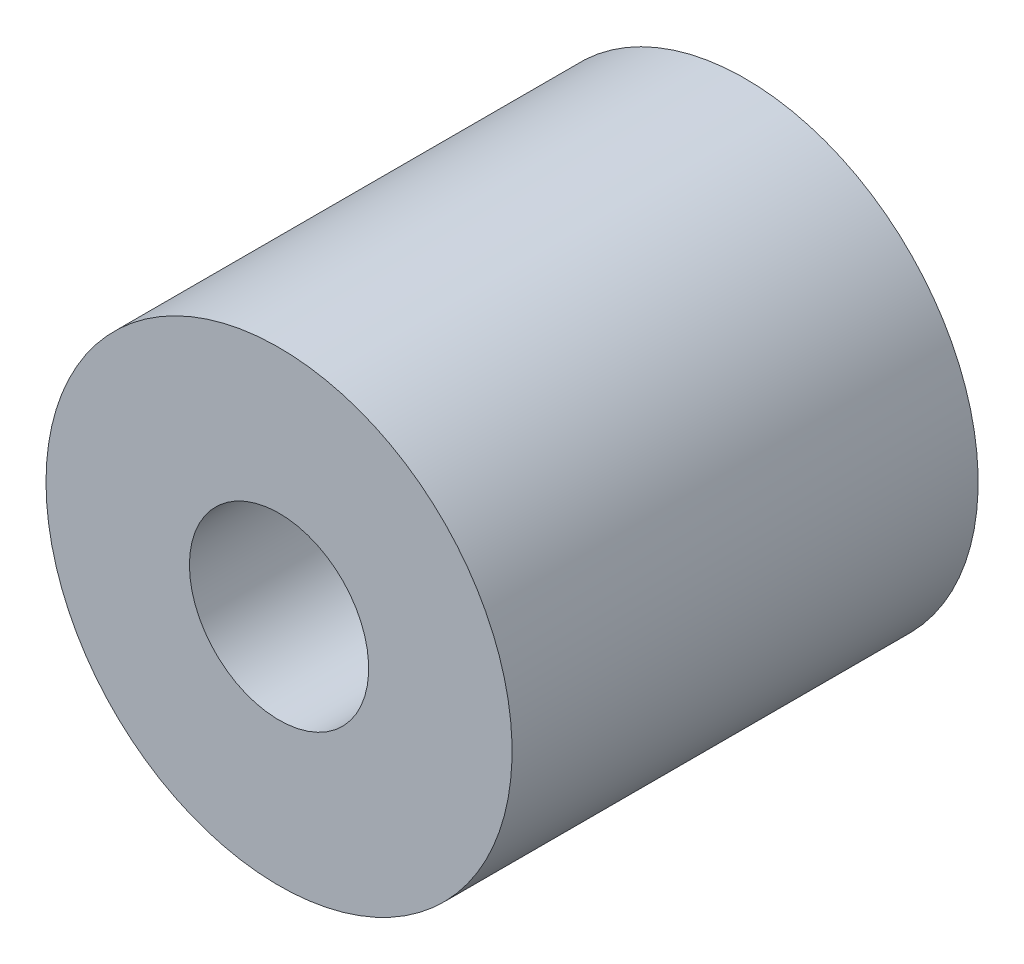
from build123d import *

# Parameters (mm, degrees)
SKETCH_1_R      = 13
SKETCH_1_R_2    = 5
EXTRUDE_1_DEPTH = 26


with BuildPart() as part:
    # 草图1 → 凸台-拉伸1 (new body)
    with BuildSketch(Plane.XY):
        Circle(SKETCH_1_R)
        Circle(SKETCH_1_R_2, mode=Mode.SUBTRACT)
    extrude(amount=EXTRUDE_1_DEPTH)


solid = part.part
